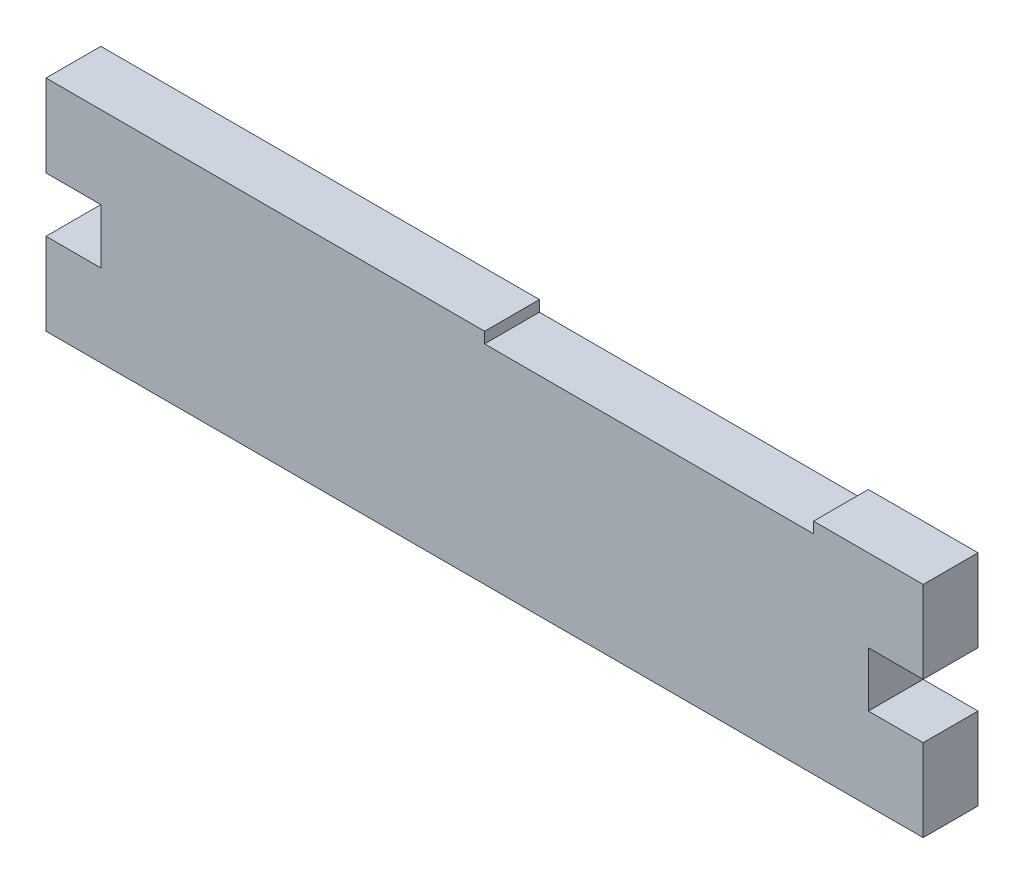
from build123d import *

# Parameters (mm, degrees)
BOSS_EXTRU_1_DEPTH = 5


with BuildPart() as part:
    # Esquisse1 → Boss.-Extru.1 (new body)
    with BuildSketch(Plane.XY):
        Polygon((0, 0), (70, 0), (75, 0), (75, 7.5), (70, 7.5), (70, 12.5), (75, 12.5), (75, 20), (70, 20), (65, 20), (65, 19), (35, 19), (35, 20), (0, 20), (-5, 20), (-5, 12.5), (0, 12.5), (0, 7.5), (-5, 7.5), (-5, 0), align=None)
    extrude(amount=BOSS_EXTRU_1_DEPTH)


solid = part.part
